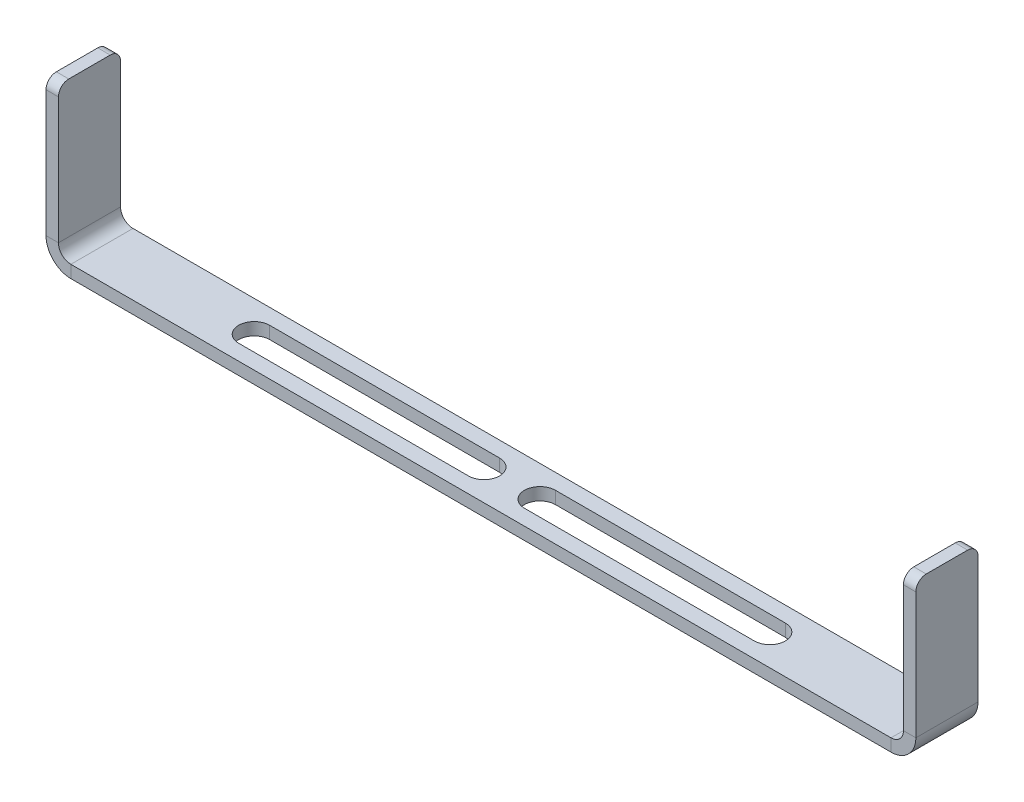
from build123d import *

# Parameters (mm, degrees)
SM_BASE_FLANGE_1_DEPTH = 15
CUT_EXTRUDE_1_DEPTH    = 10
FILLET_1_R             = 5


# Sheet-metal steps are written as plain solids
with BuildPart() as part:
    # Sketch 1 → 基体-法兰1 (new, symmetric)
    with BuildSketch(Plane.XY):
        with BuildLine():
            Line((204, 72), (204, 6))
            ThreePointArc((204, 6), (202.242640687, 1.757359313), (198, 0))
            Line((198, 0), (-198, 0))
            ThreePointArc((-198, 0), (-202.242640687, 1.757359313), (-204, 6))
            Line((-204, 6), (-204, 72))
            Line((-204, 72), (-210, 72))
            Line((-210, 72), (-210, 6))
            ThreePointArc((-210, 6), (-206.485281374, -2.485281374), (-198, -6))
            Line((-198, -6), (198, -6))
            ThreePointArc((198, -6), (206.485281374, -2.485281374), (210, 6))
            Line((210, 6), (210, 72))
            Line((210, 72), (204, 72))
        make_face()
    extrude(amount=SM_BASE_FLANGE_1_DEPTH, both=True)

    # 草图6 → 切除-拉伸1 (cut)
    with BuildSketch(Plane.XZ.offset(6)):
        with BuildLine():
            Line((13.5, 7.5), (124.5, 7.5))
            ThreePointArc((124.5, 7.5), (132, 0), (124.5, -7.5))
            Line((124.5, -7.5), (13.5, -7.5))
            ThreePointArc((13.5, -7.5), (6, 0), (13.5, 7.5))
        make_face()
        with BuildLine():
            Line((-13.5, 7.5), (-124.5, 7.5))
            ThreePointArc((-124.5, 7.5), (-132, 0), (-124.5, -7.5))
            Line((-124.5, -7.5), (-13.5, -7.5))
            ThreePointArc((-13.5, -7.5), (-6, 0), (-13.5, 7.5))
        make_face()
    extrude(amount=-CUT_EXTRUDE_1_DEPTH, mode=Mode.SUBTRACT)

    # 圆角1
    fillet_1_edges = [part.edges().sort_by_distance(p)[0] for p in [
        (-207, 72, -15),
        (207, 72, -15),
        (-207, 72, 15),
        (207, 72, 15),
    ]]
    fillet(fillet_1_edges, radius=FILLET_1_R)


solid = part.part
